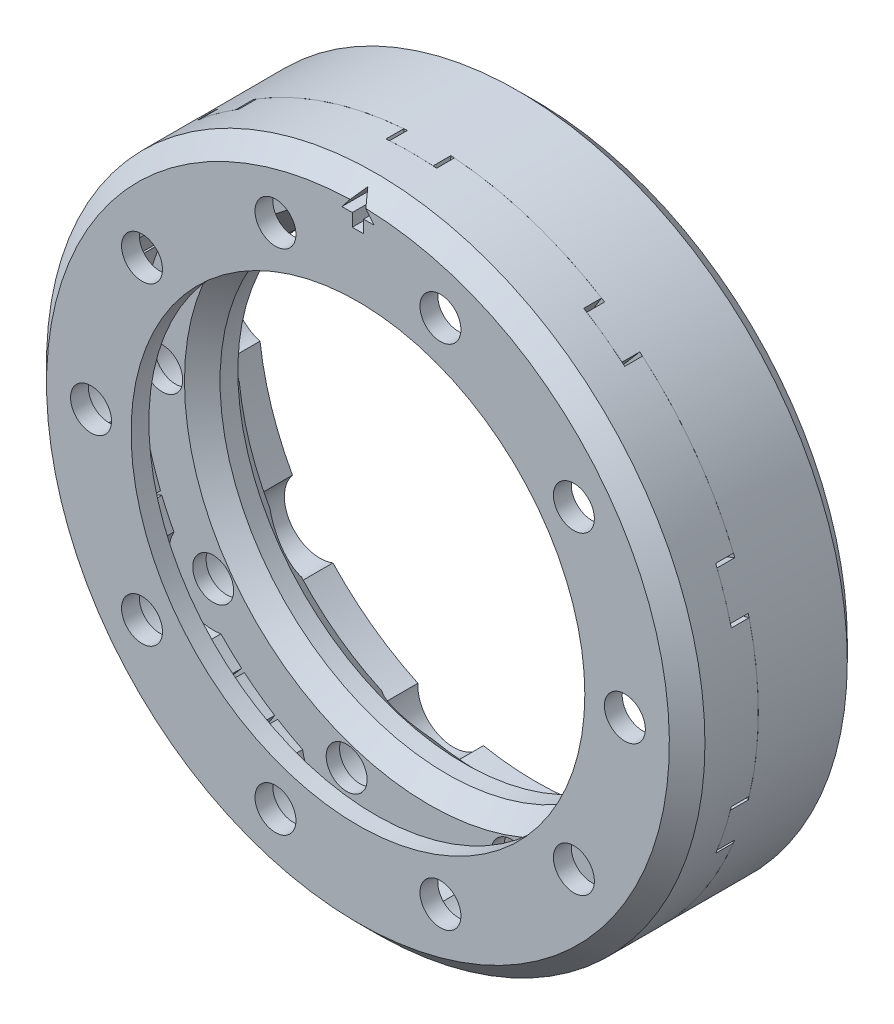
from build123d import *

# Parameters (mm, degrees)
SKETCH2_R           = 37
BOSS_EXTRUDE1_DEPTH = 6
BOSS_EXTRUDE2_START = -6
SKETCH5_R           = 37
SKETCH5_R_2         = 31.25
BOSS_EXTRUDE2_DEPTH = 6
SKETCH6_R           = 37
SKETCH6_R_2         = 25.5
BOSS_EXTRUDE3_DEPTH = 8
CUT_EXTRUDE2_DEPTH  = 57.017854297
SKETCH9_R           = 2.3
CUT_EXTRUDE4_DEPTH  = 57.017854297
SKETCH12_R          = 4
CUT_EXTRUDE10_DEPTH = 10.5
SKETCH15_R          = 5
CUT_EXTRUDE7_DEPTH  = 6
SKETCH13_R          = 25.5
CUT_EXTRUDE6_DEPTH  = 54.684262126
CIRPATTERN7_COUNT   = 10
SKETCH16_R          = 32.5
CUT_EXTRUDE8_DEPTH  = 6
CHAMFER2_SIZE       = 2
CUT_EXTRUDE11_START = -0.001
SKETCH22_R          = 37
CUT_EXTRUDE11_DEPTH = 0.001
CUT_EXTRUDE12_DEPTH = 2
CIRPATTERN9_COUNT   = 10
BOSS_EXTRUDE4_DEPTH = 2
CIRPATTERN10_COUNT  = 10
CHAMFER3_SIZE       = 2
CHAMFER4_SIZE       = 2


with BuildPart() as part:
    # Sketch2 → Boss-Extrude1 (new body)
    with BuildSketch(Plane.XY):
        Circle(SKETCH2_R)
    extrude(amount=BOSS_EXTRUDE1_DEPTH)

    # Sketch5 → Boss-Extrude2 (add)
    with BuildSketch(Plane.XY.offset(BOSS_EXTRUDE2_START)):
        Circle(SKETCH5_R)
        Circle(SKETCH5_R_2, mode=Mode.SUBTRACT)
    extrude(amount=BOSS_EXTRUDE2_DEPTH)

    # Sketch6 → Boss-Extrude3 (add)
    with BuildSketch(Plane.XY.offset(6)):
        Circle(SKETCH6_R)
        Circle(SKETCH6_R_2, mode=Mode.SUBTRACT)
    extrude(amount=BOSS_EXTRUDE3_DEPTH)

    # Sketch7 → Cut-Extrude2 (cut, through all)
    with BuildSketch(Plane.XY.offset(14)):
        Polygon((0, 32.399276449), (0.640252712, 32.399276449), (0.640252712, 33.832341534), (1.800245239, 33.832341534), (0, 36.111190156), (-1.800245239, 33.832341534), (-0.640252712, 33.832341534), (-0.640252712, 32.399276449), align=None)
    extrude(amount=-CUT_EXTRUDE2_DEPTH, mode=Mode.SUBTRACT)

    # Sketch9 → Cut-Extrude4 (cut, through all)
    with BuildSketch(Plane.XY.offset(14)):
        with Locations((30, 0)):
            Circle(SKETCH9_R)
    cut_extrude4 = extrude(amount=-CUT_EXTRUDE4_DEPTH, mode=Mode.SUBTRACT)

    # Sketch12 → Cut-Extrude10 (cut)
    with BuildSketch(Plane(origin=(0, 0, -6), x_dir=(-1, 0, 0), z_dir=(0, 0, -1))):
        with Locations(Location((-30, 0, 0), (0, 0, 255.38375331))):
            Circle(SKETCH12_R)
    cut_extrude10 = extrude(amount=-CUT_EXTRUDE10_DEPTH, mode=Mode.SUBTRACT)

    # Sketch15 → Cut-Extrude7 (cut)
    with BuildSketch(Plane.XY.offset(6)):
        with Locations((30, 0)):
            Circle(SKETCH15_R)
    cut_extrude7 = extrude(amount=CUT_EXTRUDE7_DEPTH, mode=Mode.SUBTRACT)

    # Sketch13 → Cut-Extrude6 (cut, through all)
    with BuildSketch(Plane.XY.offset(6)):
        Circle(SKETCH13_R)
    extrude(amount=-CUT_EXTRUDE6_DEPTH, mode=Mode.SUBTRACT)

    # CirPattern7: Cut-Extrude4, Cut-Extrude10, Cut-Extrude7 ×10 about axis
    cirpattern7_axis = Axis((0, 0, 0), (0, 0, 1))
    add([cut_extrude4.rotate(cirpattern7_axis, i * 360 / CIRPATTERN7_COUNT) for i in range(1, CIRPATTERN7_COUNT)], mode=Mode.SUBTRACT)
    add([cut_extrude10.rotate(cirpattern7_axis, i * 360 / CIRPATTERN7_COUNT) for i in range(1, CIRPATTERN7_COUNT)], mode=Mode.SUBTRACT)
    add([cut_extrude7.rotate(cirpattern7_axis, i * 360 / CIRPATTERN7_COUNT) for i in range(1, CIRPATTERN7_COUNT)], mode=Mode.SUBTRACT)

    # Sketch16 → Cut-Extrude8 (cut)
    with BuildSketch(Plane.XY.offset(6)):
        Circle(SKETCH16_R)
    extrude(amount=CUT_EXTRUDE8_DEPTH, mode=Mode.SUBTRACT)

    # Chamfer2
    # the kernel refuses this chamfer: 2 mm, written as the material it takes off along each edge
    with BuildSketch(Plane(origin=(0, 0, 0), x_dir=(1, 0, 0), z_dir=(0, -1, 0))) as chamfer2_piece_1:
        Polygon((25.5 + CHAMFER2_SIZE, 0), (25.5, CHAMFER2_SIZE), (25.5, 0), align=None)
    revolve(axis=Axis((0, 0, 0), (0, 0, 1)), mode=Mode.SUBTRACT)
    with BuildSketch(Plane(origin=(0, 0, 6), x_dir=(1, 0, 0), z_dir=(0, 1, 0))) as chamfer2_piece_2:
        Polygon((25.5 + CHAMFER2_SIZE, 0), (25.5, CHAMFER2_SIZE), (25.5, 0), align=None)
    revolve(axis=Axis((0, 0, 6), (0, 0, -1)), mode=Mode.SUBTRACT)

    # Sketch22 → Cut-Extrude11 (cut)
    with BuildSketch(Plane.XY.offset(6).offset(CUT_EXTRUDE11_START)):
        Circle(SKETCH22_R)
    extrude(amount=CUT_EXTRUDE11_DEPTH, mode=Mode.SUBTRACT)


with BuildPart() as cut_extrude11_piece_1:
    # of the separate pieces the step leaves, piece 1, a body of its own (cut_extrude11_pieces)
    add(part.part.solids().sort_by_distance((37, 0, 5.999))[0])

    # Sketch24 → Boss-Extrude4 (add)
    with BuildSketch(Plane.XY.offset(5.999)):
        with BuildLine():
            Line((-2.447172709, -36.918983541), (-2.100995832, -32.432018385))
            ThreePointArc((-2.100995832, -32.432018385), (0, -32.5), (2.100995832, -32.432018385))
            Line((2.100995832, -32.432018385), (2.447172709, -36.918983541))
            ThreePointArc((2.447172709, -36.918983541), (0, -37), (-2.447172709, -36.918983541))
        make_face()
    boss_extrude4 = extrude(amount=BOSS_EXTRUDE4_DEPTH)

    # CirPattern10: Boss-Extrude4 ×10 about axis
    cirpattern10_axis = Axis((0, 0, 0), (0, 0, 1))
    for i in range(1, CIRPATTERN10_COUNT):
        add(boss_extrude4.rotate(cirpattern10_axis, i * 360 / CIRPATTERN10_COUNT))

    # Chamfer3
    # the kernel refuses this chamfer: 2 mm, written as the material it takes off along each edge
    with BuildSketch(Plane(origin=(0, 0, -6), x_dir=(1, 0, 0), z_dir=(0, -1, 0))) as chamfer3_piece_1:
        Polygon((37, CHAMFER3_SIZE), (37 - CHAMFER3_SIZE, 0), (37, 0), align=None)
    revolve(axis=Axis((0, 0, -6), (0, 0, 1)), mode=Mode.SUBTRACT)


with BuildPart() as cut_extrude11_piece_2:
    # of the separate pieces the step leaves, piece 2, a body of its own (cut_extrude11_pieces)
    add(part.part.solids().sort_by_distance((37, 0, 6))[0])

    # Sketch23 → Cut-Extrude12 (cut)
    with BuildSketch(Plane(origin=(0, 0, 6), x_dir=(-1, 0, 0), z_dir=(0, 0, -1))):
        with BuildLine():
            Line((-2.5, -32.403703492), (-2.846153846, -36.890370129))
            ThreePointArc((-2.846153846, -36.890370129), (0, -37), (2.846153846, -36.890370129))
            Line((2.846153846, -36.890370129), (2.5, -32.403703492))
            ThreePointArc((2.5, -32.403703492), (0, -32.5), (-2.5, -32.403703492))
        make_face()
    cut_extrude12 = extrude(amount=-CUT_EXTRUDE12_DEPTH, mode=Mode.SUBTRACT)

    # CirPattern9: Cut-Extrude12 ×10 about axis
    cirpattern9_axis = Axis((0, 0, 0), (0, 0, 1))
    for i in range(1, CIRPATTERN9_COUNT):
        add(cut_extrude12.rotate(cirpattern9_axis, i * 360 / CIRPATTERN9_COUNT), mode=Mode.SUBTRACT)

    # Chamfer4
    # the kernel refuses this chamfer: 2 mm, written as the material it takes off along each edge
    with BuildSketch(Plane(origin=(0, 0, 14), x_dir=(1, 0, 0), z_dir=(0, -1, 0))) as chamfer4_piece_1:
        Polygon((37, -CHAMFER4_SIZE), (37 - CHAMFER4_SIZE, 0), (37, 0), align=None)
    revolve(axis=Axis((0, 0, 14), (0, 0, 1)), mode=Mode.SUBTRACT)


solid = Compound([cut_extrude11_piece_1.part, cut_extrude11_piece_2.part])
